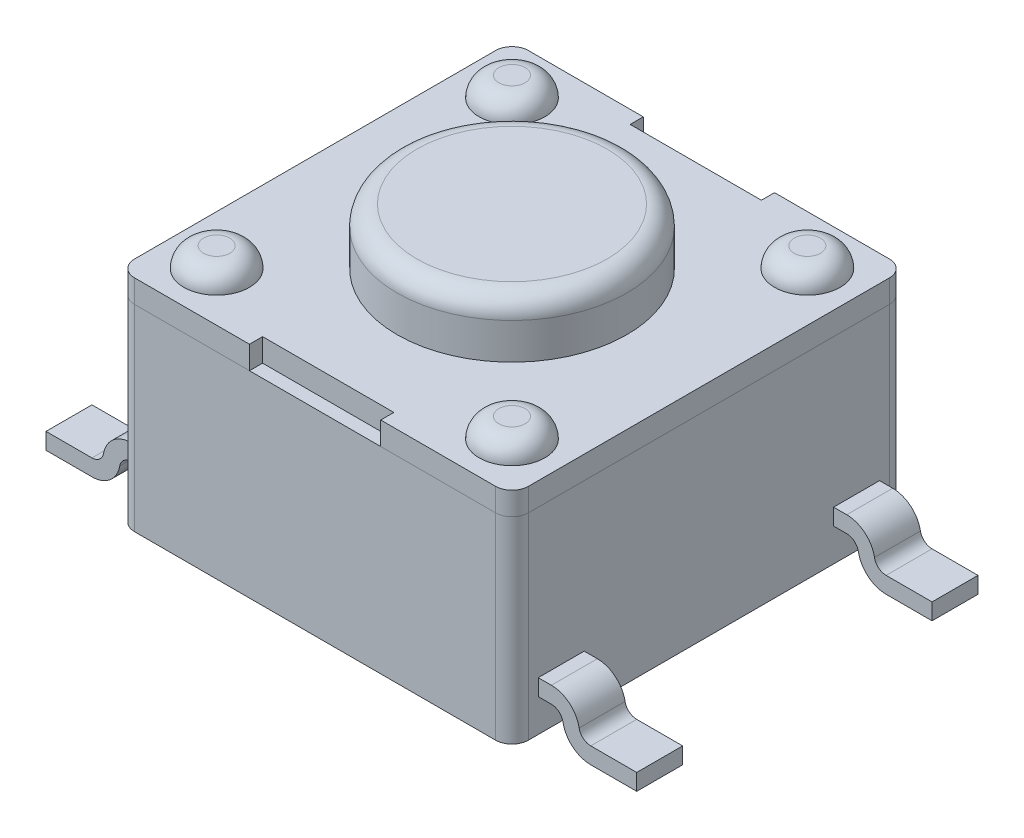
from build123d import *

# Parameters (mm, degrees)
SKETCH1_W             = 6
SKETCH1_H             = 6
BOSS_EXTRUDE1_DEPTH   = 3
BOSS_EXTRUDE4_DEPTH   = 0.35
SKETCH2_R             = 1.75
BOSS_EXTRUDE2_DEPTH   = 0.85
SKETCH3_R             = 0.5
BOSS_EXTRUDE3_DEPTH   = 0.3
BOSS_EXTRUDE3_2_DEPTH = 0.3
BOSS_EXTRUDE3_3_DEPTH = 0.3
BOSS_EXTRUDE3_4_DEPTH = 0.3
BOSS_EXTRUDE5_START   = -0.4
BOSS_EXTRUDE5_DEPTH   = 0.7
LPATTERN1_COUNT       = 2
LPATTERN1_PITCH       = 4.5
FILLET1_R             = 0.25
FILLET2_R             = 0.25
FILLET3_R             = 0.3
FILLET4_R             = 0.3
FILLET5_R             = 0.3
FILLET6_R             = 0.3
FILLET7_R             = 0.3


with BuildPart() as part:
    # Sketch1 → Boss-Extrude1 (new body)
    with BuildSketch(Plane(origin=(0, 0, 0), x_dir=(1, 0, 0), z_dir=(0, 1, 0))):
        Rectangle(SKETCH1_W, SKETCH1_H)
    extrude(amount=BOSS_EXTRUDE1_DEPTH)

    # Sketch5 → Boss-Extrude5 (add)
    with BuildSketch(Plane.XY.offset(3).offset(BOSS_EXTRUDE5_START)):
        with BuildLine():
            Line((3, 0.75), (3.2, 0.75))
            ThreePointArc((3.2, 0.75), (3.475279292, 0.65033515), (3.62295082, 0.397540984))
            ThreePointArc((3.62295082, 0.397540984), (3.684766808, 0.29172017), (3.8, 0.25))
            Line((3.8, 0.25), (4.5, 0.25))
            Line((4.5, 0.25), (4.5, 0))
            Line((4.5, 0), (3.8, 0))
            ThreePointArc((3.8, 0), (3.524720708, 0.09966485), (3.37704918, 0.352459016))
            ThreePointArc((3.37704918, 0.352459016), (3.315233192, 0.45827983), (3.2, 0.5))
            Line((3.2, 0.5), (3, 0.5))
            Line((3, 0.5), (3, 0.75))
        make_face()
        with BuildLine():
            Line((-3.2, 0.5), (-3, 0.5))
            Line((-3, 0.5), (-3, 0.75))
            Line((-3, 0.75), (-3.2, 0.75))
            ThreePointArc((-3.2, 0.75), (-3.475279292, 0.65033515), (-3.62295082, 0.397540984))
            ThreePointArc((-3.62295082, 0.397540984), (-3.684766808, 0.29172017), (-3.8, 0.25))
            Line((-3.8, 0.25), (-4.5, 0.25))
            Line((-4.5, 0.25), (-4.5, 0))
            Line((-4.5, 0), (-3.8, 0))
            ThreePointArc((-3.8, 0), (-3.524720708, 0.09966485), (-3.37704918, 0.352459016))
            ThreePointArc((-3.37704918, 0.352459016), (-3.315233192, 0.45827983), (-3.2, 0.5))
        make_face()
    boss_extrude5 = extrude(amount=-BOSS_EXTRUDE5_DEPTH)

    # LPattern1: Boss-Extrude5 ×2
    with Locations(*[(0, 0, -i * LPATTERN1_PITCH) for i in range(1, LPATTERN1_COUNT)]):
        add(boss_extrude5)

    # Fillet1
    fillet1_edges = [part.edges().sort_by_distance(p)[0] for p in [
        (-3, 1.5, -3),
        (3, 1.5, -3),
        (3, 1.5, 3),
        (-3, 1.5, 3),
    ]]
    fillet(fillet1_edges, radius=FILLET1_R)


with BuildPart() as body_2:
    # Sketch4 → Boss-Extrude4 (new body)
    with BuildSketch(Plane(origin=(0, 3, 0), x_dir=(1, 0, 0), z_dir=(0, 1, 0))):
        Polygon((-3, -3), (-1, -3), (-1, -2.8), (1, -2.8), (1, -3), (3, -3), (3, 3), (1, 3), (1, 2.8), (-1, 2.8), (-1, 3), (-3, 3), align=None)
    extrude(amount=BOSS_EXTRUDE4_DEPTH)

    # Fillet2
    fillet2_edges = [body_2.edges().sort_by_distance(p)[0] for p in [
        (3, 3.175, -3),
        (3, 3.175, 3),
        (-3, 3.175, 3),
        (-3, 3.175, -3),
    ]]
    fillet(fillet2_edges, radius=FILLET2_R)


with BuildPart() as body_3:
    # Sketch2 → Boss-Extrude2 (new body)
    with BuildSketch(Plane(origin=(0, 3.35, 0), x_dir=(1, 0, 0), z_dir=(0, 1, 0))):
        with Locations(Location((0, 0, 0), (0, 0, 270))):
            Circle(SKETCH2_R)
    extrude(amount=BOSS_EXTRUDE2_DEPTH)

    # Fillet7
    fillet7_edges = [body_3.edges().sort_by_distance(p)[0] for p in [
        (0, 4.2, -1.75),
    ]]
    fillet(fillet7_edges, radius=FILLET7_R)


with BuildPart() as body_4:
    # Sketch3 → Boss-Extrude3 (new body)
    with BuildSketch(Plane(origin=(0, 3.35, 0), x_dir=(1, 0, 0), z_dir=(0, 1, 0))):
        with Locations(Location((2.25, -2.25, 0), (0, 0, 270))):
            Circle(SKETCH3_R)
    extrude(amount=BOSS_EXTRUDE3_DEPTH)

    # Fillet3
    # the kernel refuses this fillet: 0.3 mm, written as the material it takes off along each edge
    with BuildSketch(Plane(origin=(2.25, 3.65, 2.25), x_dir=(0, 0, 1), z_dir=(-1, 0, 0))) as fillet3_piece_1:
        with BuildLine():
            CenterArc((0.5 - FILLET3_R, -FILLET3_R), FILLET3_R, 0, 90)
            Line((0.5 - FILLET3_R, 0), (0.5, 0))
            Line((0.5, 0), (0.5, -FILLET3_R))
        make_face()
    revolve(axis=Axis((2.25, 3.65, 2.25), (0, 1, 0)), mode=Mode.SUBTRACT)


with BuildPart() as body_5:
    # Sketch3 → Boss-Extrude3 2 (new body)
    with BuildSketch(Plane(origin=(0, 3.35, 0), x_dir=(1, 0, 0), z_dir=(0, 1, 0))):
        with Locations(Location((2.25, 2.25, 0), (0, 0, 270))):
            Circle(SKETCH3_R)
    extrude(amount=BOSS_EXTRUDE3_2_DEPTH)

    # Fillet6
    # the kernel refuses this fillet: 0.3 mm, written as the material it takes off along each edge
    with BuildSketch(Plane(origin=(2.25, 3.65, -2.25), x_dir=(0, 0, 1), z_dir=(-1, 0, 0))) as fillet6_piece_1:
        with BuildLine():
            CenterArc((0.5 - FILLET6_R, -FILLET6_R), FILLET6_R, 0, 90)
            Line((0.5 - FILLET6_R, 0), (0.5, 0))
            Line((0.5, 0), (0.5, -FILLET6_R))
        make_face()
    revolve(axis=Axis((2.25, 3.65, -2.25), (0, 1, 0)), mode=Mode.SUBTRACT)


with BuildPart() as body_6:
    # Sketch3 → Boss-Extrude3 3 (new body)
    with BuildSketch(Plane(origin=(0, 3.35, 0), x_dir=(1, 0, 0), z_dir=(0, 1, 0))):
        with Locations(Location((-2.25, 2.25, 0), (0, 0, 270))):
            Circle(SKETCH3_R)
    extrude(amount=BOSS_EXTRUDE3_3_DEPTH)

    # Fillet5
    # the kernel refuses this fillet: 0.3 mm, written as the material it takes off along each edge
    with BuildSketch(Plane(origin=(-2.25, 3.65, -2.25), x_dir=(0, 0, 1), z_dir=(-1, 0, 0))) as fillet5_piece_1:
        with BuildLine():
            CenterArc((0.5 - FILLET5_R, -FILLET5_R), FILLET5_R, 0, 90)
            Line((0.5 - FILLET5_R, 0), (0.5, 0))
            Line((0.5, 0), (0.5, -FILLET5_R))
        make_face()
    revolve(axis=Axis((-2.25, 3.65, -2.25), (0, 1, 0)), mode=Mode.SUBTRACT)


with BuildPart() as body_7:
    # Sketch3 → Boss-Extrude3 4 (new body)
    with BuildSketch(Plane(origin=(0, 3.35, 0), x_dir=(1, 0, 0), z_dir=(0, 1, 0))):
        with Locations(Location((-2.25, -2.25, 0), (0, 0, 270))):
            Circle(SKETCH3_R)
    extrude(amount=BOSS_EXTRUDE3_4_DEPTH)

    # Fillet4
    # the kernel refuses this fillet: 0.3 mm, written as the material it takes off along each edge
    with BuildSketch(Plane(origin=(-2.25, 3.65, 2.25), x_dir=(0, 0, 1), z_dir=(-1, 0, 0))) as fillet4_piece_1:
        with BuildLine():
            CenterArc((0.5 - FILLET4_R, -FILLET4_R), FILLET4_R, 0, 90)
            Line((0.5 - FILLET4_R, 0), (0.5, 0))
            Line((0.5, 0), (0.5, -FILLET4_R))
        make_face()
    revolve(axis=Axis((-2.25, 3.65, 2.25), (0, 1, 0)), mode=Mode.SUBTRACT)


solid = Compound([part.part, body_2.part, body_3.part, body_4.part, body_5.part, body_6.part, body_7.part])
